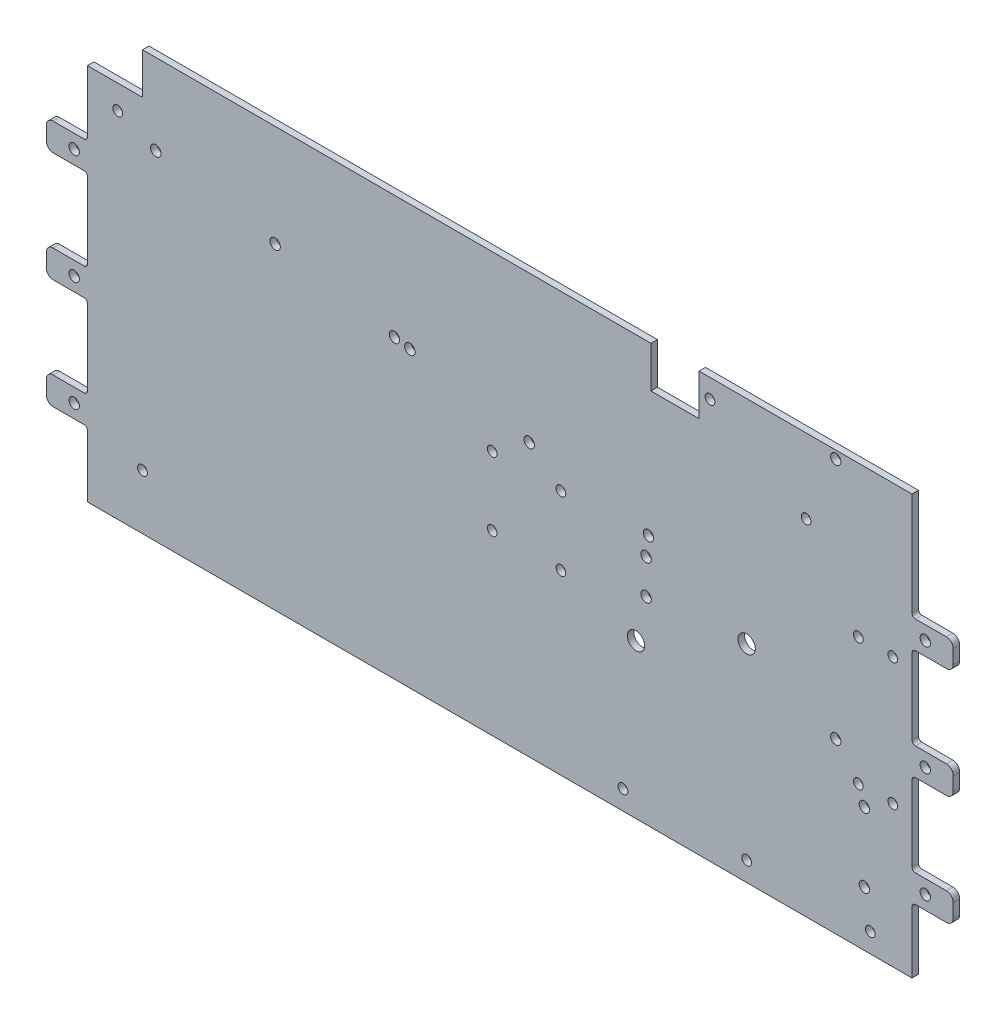
from build123d import *

# Parameters (mm, degrees)
SKETCH1_W                  = 381
SKETCH1_H                  = 193.675
BOSS_EXTRUDE1_DEPTH        = 1.5
CUT_EXTRUDE1_DEPTH         = 214.72120018
CUT_EXTRUDE1_DEPTH_BACK    = 214.72120018
SKETCH2_W                  = 25.4
SKETCH2_H                  = 19.05
SKETCH2_W_2                = 22.225
SKETCH3_W                  = 19.05
SKETCH3_H                  = 12.7
BOSS_EXTRUDE2_DEPTH        = 3
FILLET1_R                  = 3.175
FILLET1_OF_MIRROR1_R       = 3.175
FILLET2_R                  = 1.5875
LPATTERN1_START            = -1.5
LPATTERN1_DEPTH            = 3
F_1_0MM_DOWEL_HOLE6_D      = 8
F_1_0MM_DOWEL_HOLE5_D      = 8
F_8_CLEARANCE_HOLE1_D      = 4.4958
F_1_0MM_DOWEL_HOLE1_D      = 4.8
F_1_0_4_8_DIAMETER_HOLE1_D = 4.8
LPATTERN2_COUNT            = 2
LPATTERN2_PITCH            = 50.8
LPATTERN2_COL_COUNT        = 2
LPATTERN2_COL_PITCH        = 50.8
MIRROR2_COPY_1_D           = 4.8
MIRROR2_COPY_2_D           = 4.8


# Read off the part's stored shape, not the designer's step: LPattern1
with BuildPart() as part:
    # Sketch1 → Boss-Extrude1 (new, symmetric)
    with BuildSketch(Plane.XY):
        Rectangle(SKETCH1_W, SKETCH1_H)
    extrude(amount=BOSS_EXTRUDE1_DEPTH, both=True)

    # Sketch2 → Cut-Extrude1 (cut, two sides: drawn at the far end of the back side and taken through both)
    with BuildSketch(Plane.XY.offset(1.5).offset(-CUT_EXTRUDE1_DEPTH_BACK)):
        with Locations((-177.8, 87.3125)):
            Rectangle(SKETCH2_W, SKETCH2_H)
        with Locations((80.9625, 87.3125)):
            Rectangle(SKETCH2_W_2, SKETCH2_H)
    extrude(amount=CUT_EXTRUDE1_DEPTH + CUT_EXTRUDE1_DEPTH_BACK, mode=Mode.SUBTRACT)

    # Sketch3 → Boss-Extrude2 (add)
    with BuildSketch(Plane.XY.offset(1.5)):
        with Locations((-200.025, -9.525)):
            Rectangle(SKETCH3_W, SKETCH3_H)
    boss_extrude2 = extrude(amount=-BOSS_EXTRUDE2_DEPTH)

    # Fillet1
    fillet1_edges = [part.edges().sort_by_distance(p)[0] for p in [
        (-209.55, -3.175, 0),
        (-209.55, -15.875, 0),
    ]]
    fillet(fillet1_edges, radius=FILLET1_R)

    # Mirror1: Boss-Extrude2 across plane
    add(boss_extrude2.mirror(Plane(origin=(0, 0, 0), x_dir=(0, 0, 1), z_dir=(1, 0, 0))))

    # Fillet1 of Mirror1
    fillet1_of_mirror1_edges = [part.edges().sort_by_distance(p)[0] for p in [
        (209.55, -3.175, 0),
        (209.55, -15.875, 0),
    ]]
    fillet(fillet1_of_mirror1_edges, radius=FILLET1_OF_MIRROR1_R)

    # Fillet2
    fillet2_edges = [part.edges().sort_by_distance(p)[0] for p in [
        (-190.5, -15.875, 0),
        (-190.5, -3.175, 0),
        (190.5, -15.875, 0),
        (190.5, -3.175, 0),
    ]]
    fillet(fillet2_edges, radius=FILLET2_R)

    # LPattern1 outline → LPattern1 (add)
    with BuildSketch(Plane.XY.offset(LPATTERN1_START)):
        with BuildLine():
            ThreePointArc((-206.375, 47.625), (-208.62006403, 46.69506403), (-209.55, 44.45))
            Line((-209.55, 44.45), (-209.55, 38.1))
            ThreePointArc((-209.55, 38.1), (-208.62006403, 35.85493597), (-206.375, 34.925))
            Line((-206.375, 34.925), (-192.0875, 34.925))
            ThreePointArc((-192.0875, 34.925), (-190.964967985, 34.460032015), (-190.5, 33.3375))
            Line((-190.5, 33.3375), (-190.5, 49.2125))
            ThreePointArc((-190.5, 49.2125), (-190.964967985, 48.089967985), (-192.0875, 47.625))
            Line((-192.0875, 47.625), (-206.375, 47.625))
        make_face()
        with BuildLine():
            ThreePointArc((-206.375, -53.975), (-208.62006403, -54.90493597), (-209.55, -57.15))
            Line((-209.55, -57.15), (-209.55, -63.5))
            ThreePointArc((-209.55, -63.5), (-208.62006403, -65.74506403), (-206.375, -66.675))
            Line((-206.375, -66.675), (-192.0875, -66.675))
            ThreePointArc((-192.0875, -66.675), (-190.964967985, -67.139967985), (-190.5, -68.2625))
            Line((-190.5, -68.2625), (-190.5, -52.3875))
            ThreePointArc((-190.5, -52.3875), (-190.964967985, -53.510032015), (-192.0875, -53.975))
            Line((-192.0875, -53.975), (-206.375, -53.975))
        make_face()
        with BuildLine():
            Line((209.55, 38.1), (209.55, 44.45))
            ThreePointArc((209.55, 44.45), (208.62006403, 46.69506403), (206.375, 47.625))
            Line((206.375, 47.625), (192.0875, 47.625))
            ThreePointArc((192.0875, 47.625), (190.964967985, 48.089967985), (190.5, 49.2125))
            Line((190.5, 49.2125), (190.5, 33.3375))
            ThreePointArc((190.5, 33.3375), (190.964967985, 34.460032015), (192.0875, 34.925))
            Line((192.0875, 34.925), (206.375, 34.925))
            ThreePointArc((206.375, 34.925), (208.62006403, 35.85493597), (209.55, 38.1))
        make_face()
        with BuildLine():
            Line((209.55, -63.5), (209.55, -57.15))
            ThreePointArc((209.55, -57.15), (208.62006403, -54.90493597), (206.375, -53.975))
            Line((206.375, -53.975), (192.0875, -53.975))
            ThreePointArc((192.0875, -53.975), (190.964967985, -53.510032015), (190.5, -52.3875))
            Line((190.5, -52.3875), (190.5, -68.2625))
            ThreePointArc((190.5, -68.2625), (190.964967985, -67.139967985), (192.0875, -66.675))
            Line((192.0875, -66.675), (206.375, -66.675))
            ThreePointArc((206.375, -66.675), (208.62006403, -65.74506403), (209.55, -63.5))
        make_face()
    extrude(amount=LPATTERN1_DEPTH)

    # Ø1.0mm Dowel Hole6 (through all)
    with Locations(Plane.XY.offset(1.5)):
        with Locations((114.080868605, -1.328387664)):
            Hole(F_1_0MM_DOWEL_HOLE6_D / 2)

    # Ø1.0mm Dowel Hole5 (through all)
    with Locations(Plane.XY.offset(1.5)):
        with Locations((62.931618599, -25.649221104)):
            Hole(F_1_0MM_DOWEL_HOLE5_D / 2)

    # #8 Clearance Hole1 (through all)
    with Locations(Plane(origin=(0, 0, -1.5), x_dir=(-1, 0, 0), z_dir=(0, 0, -1))):
        with Locations((3.488631395, 16.97194676), (-28.261368605, 16.97194676), (-28.261368605, -14.77805324), (3.488631395, -14.77805324), (-56.930868605, -87.847137664), (-114.080868605, -87.847137664), (-171.230868605, -87.847137664), (-165.723368605, 27.246612336), (-181.598368605, 27.246612336), (-181.598368605, -31.490887664), (-165.723368605, -31.490887664), (176.53, 66.736172691), (-97.1296, 88.08565122), (-141.5796, 62.422431754), (165.1, -71.4375)):
            Hole(F_8_CLEARANCE_HOLE1_D / 2)

    # Ø1.0mm Dowel Hole1 (through all)
    with Locations(Plane.XY.offset(1.5)):
        with Locations((-158.944770876, 59.513399002), (-48.646302539, 40.064803103), (-103.795536708, 49.789101052), (-41.555686717, 38.814536224), (13.593547451, 29.090238275), (68.74278162, 19.365940325), (67.618368605, 10.356435791), (67.618368605, -5.643564209), (155.263089531, -18.7625), (155.263089531, 93.2375), (168.480868605, -71.388387664), (168.480868605, -39.388387664)):
            Hole(F_1_0MM_DOWEL_HOLE1_D / 2)

    # Ø1.0 (4.8) Diameter Hole1 (through all)
    with Locations(Plane.XY.offset(1.5)):
        with Locations((196.65, -9.525)):
            f_1_0_4_8_diameter_hole1 = Hole(F_1_0_4_8_DIAMETER_HOLE1_D / 2)

    # LPattern2: Ø1.0 (4.8) Diameter Hole1 ×2
    with Locations(*[(0, i * LPATTERN2_PITCH, 0) for i in range(1, LPATTERN2_COUNT)]):
        add(f_1_0_4_8_diameter_hole1, mode=Mode.SUBTRACT)

    # LPattern2 col: Ø1.0 (4.8) Diameter Hole1 ×2
    with Locations(*[(0, -i * LPATTERN2_COL_PITCH, 0) for i in range(1, LPATTERN2_COL_COUNT)]):
        add(f_1_0_4_8_diameter_hole1, mode=Mode.SUBTRACT)

    # Mirror2: Ø1.0 (4.8) Diameter Hole1 across plane
    add(f_1_0_4_8_diameter_hole1.mirror(Plane(origin=(0, 0, 0), x_dir=(0, 0, 1), z_dir=(1, 0, 0))), mode=Mode.SUBTRACT)

    # Mirror2 copy 1 (through all)
    with Locations(Plane(origin=(0, 50.8, 1.5), x_dir=(-1, 0, 0), z_dir=(0, 0, 1))):
        with Locations((196.65, 9.525)):
            Hole(MIRROR2_COPY_1_D / 2)

    # Mirror2 copy 2 (through all)
    with Locations(Plane(origin=(0, -50.8, 1.5), x_dir=(-1, 0, 0), z_dir=(0, 0, 1))):
        with Locations((196.65, 9.525)):
            Hole(MIRROR2_COPY_2_D / 2)


solid = part.part
